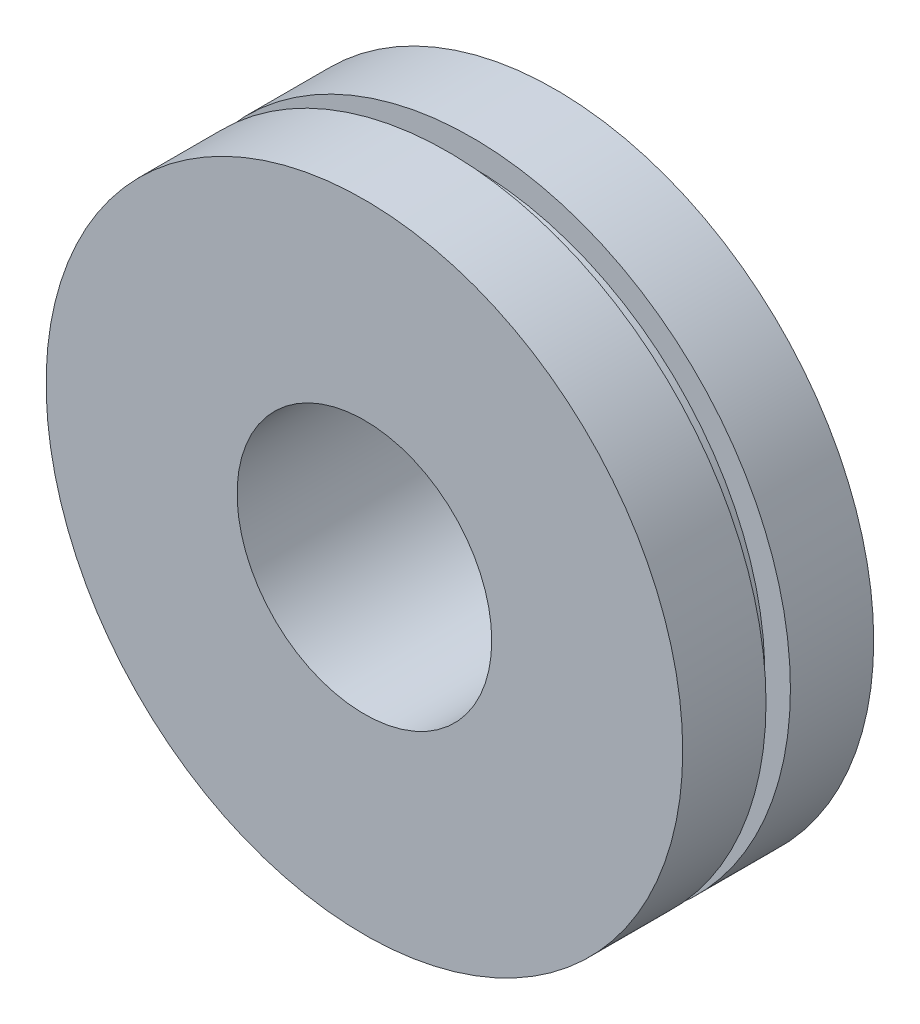
from build123d import *

# Parameters (mm, degrees)
SKETCH1_R                = 13.05
SKETCH1_R_2              = 5.22
BOSS_EXTRUDE1_DEPTH      = 7.83
CUT_EXTRUDE1_START       = 3.415
CUT_EXTRUDE1_OUTLINE_R   = 13.05
CUT_EXTRUDE1_OUTLINE_R_2 = 12
CUT_EXTRUDE1_DEPTH       = 1


# Read off the part's stored shape, not the designer's step: Cut-Extrude1
with BuildPart() as part:
    # Sketch1 → Boss-Extrude1 (new body)
    with BuildSketch(Plane.XY):
        Circle(SKETCH1_R)
        Circle(SKETCH1_R_2, mode=Mode.SUBTRACT)
    extrude(amount=BOSS_EXTRUDE1_DEPTH)

    # Cut-Extrude1 outline → Cut-Extrude1 (cut)
    with BuildSketch(Plane.XY.offset(CUT_EXTRUDE1_START)):
        Circle(CUT_EXTRUDE1_OUTLINE_R)
        Circle(CUT_EXTRUDE1_OUTLINE_R_2, mode=Mode.SUBTRACT)
    extrude(amount=CUT_EXTRUDE1_DEPTH, mode=Mode.SUBTRACT)


solid = part.part
